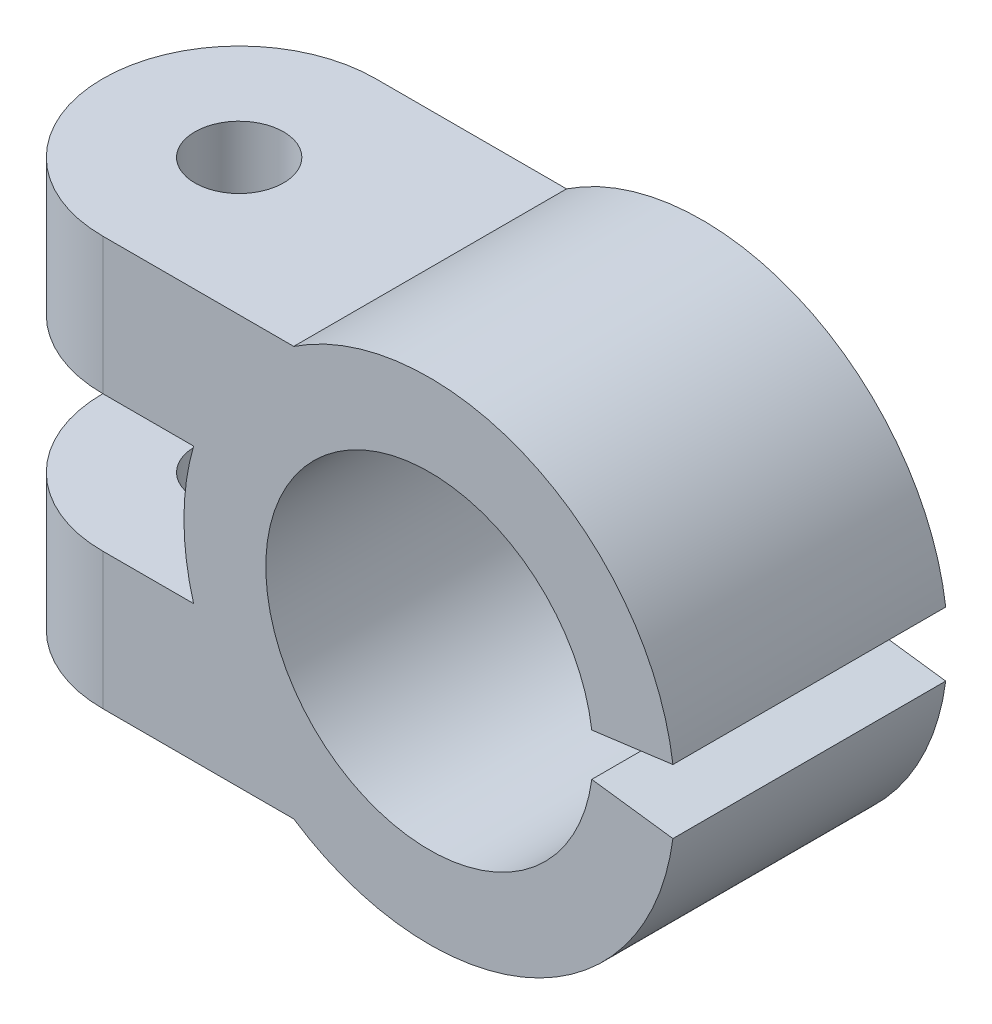
from build123d import *

# Parameters (mm, degrees)
CROQUIS1_R              = 9
CROQUIS1_R_2            = 6
SALIENTE_EXTRUIR1_DEPTH = 10
CORTAR_EXTRUIR1_DEPTH   = 17.186414056
SALIENTE_EXTRUIR2_START = -10
SALIENTE_EXTRUIR2_DEPTH = 10
REDONDEO1_R             = 5
CROQUIS4_R              = 1.625
CORTAR_EXTRUIR2_DEPTH   = 26.698219636
CORTAR_EXTRUIR4_DEPTH   = 22.659835929
CROQUIS6_R              = 5.5
CORTAR_EXTRUIR5_DEPTH   = 2.5
CORTAR_EXTRUIR6_DEPTH   = 2.3


with BuildPart() as part:
    # Croquis1 → Saliente-Extruir1 (new body)
    with BuildSketch(Plane.XY):
        Circle(CROQUIS1_R)
        Circle(CROQUIS1_R_2, mode=Mode.SUBTRACT)
    extrude(amount=SALIENTE_EXTRUIR1_DEPTH)

    # Croquis2 → Cortar-Extruir1 (cut, through all)
    with BuildSketch(Plane.XY.offset(10)):
        with BuildLine():
            Line((0, 0), (8.923003752, 1.17473573))
            ThreePointArc((8.923003752, 1.17473573), (9, 0), (8.923003752, -1.17473573))
            Line((8.923003752, -1.17473573), (0, 0))
        make_face()
    extrude(amount=-CORTAR_EXTRUIR1_DEPTH, mode=Mode.SUBTRACT)

    # Croquis3 → Saliente-Extruir2 (add)
    with BuildSketch(Plane.XY.offset(10).offset(SALIENTE_EXTRUIR2_START)):
        with BuildLine():
            Line((-4.974937186, 7.5), (-16.974937186, 7.5))
            Line((-16.974937186, 7.5), (-16.974937186, -7.5))
            Line((-16.974937186, -7.5), (-4.974937186, -7.5))
            ThreePointArc((-4.974937186, -7.5), (-9, 0), (-4.974937186, 7.5))
        make_face()
    extrude(amount=SALIENTE_EXTRUIR2_DEPTH)

    # Redondeo1
    redondeo1_edges = [part.edges().sort_by_distance(p)[0] for p in [
        (-16.974937186, 0, 0),
        (-16.974937186, 0, 10),
    ]]
    fillet(redondeo1_edges, radius=REDONDEO1_R - 0.0001)  # a hair under: the kernel refuses the full size

    # Croquis4 → Cortar-Extruir2 (cut, through all)
    with BuildSketch(Plane.XZ.offset(7.5)):
        with Locations((-11.974937186, 5)):
            Circle(CROQUIS4_R)
    extrude(amount=-CORTAR_EXTRUIR2_DEPTH, mode=Mode.SUBTRACT)

    # Croquis5 → Cortar-Extruir4 (cut, through all)
    with BuildSketch(Plane.XY.offset(10)):
        with BuildLine():
            Line((-8.645808233, 2.5), (-21.808614769, 2.5))
            Line((-21.808614769, 2.5), (-21.808614769, -2.5))
            Line((-21.808614769, -2.5), (-8.645808233, -2.5))
            ThreePointArc((-8.645808233, -2.5), (-9, 0), (-8.645808233, 2.5))
        make_face()
    extrude(amount=-CORTAR_EXTRUIR4_DEPTH, mode=Mode.SUBTRACT)

    # Croquis6 → Cortar-Extruir5 (cut, symmetric)
    with BuildSketch(Plane(origin=(0, 0, 0), x_dir=(1, 0, 0), z_dir=(0, 1, 0))):
        with Locations((-11.974937186, -5)):
            Circle(CROQUIS6_R)
    extrude(amount=CORTAR_EXTRUIR5_DEPTH, both=True, mode=Mode.SUBTRACT)

    # Croquis7 → Cortar-Extruir6 (cut)
    with BuildSketch(Plane.XZ.offset(7.5)):
        Polygon((-8.799510705, 5), (-10.387223945, 7.75), (-13.562650426, 7.75), (-15.150363666, 5), (-13.562650426, 2.25), (-10.387223945, 2.25), align=None)
    extrude(amount=-CORTAR_EXTRUIR6_DEPTH, mode=Mode.SUBTRACT)


solid = part.part
